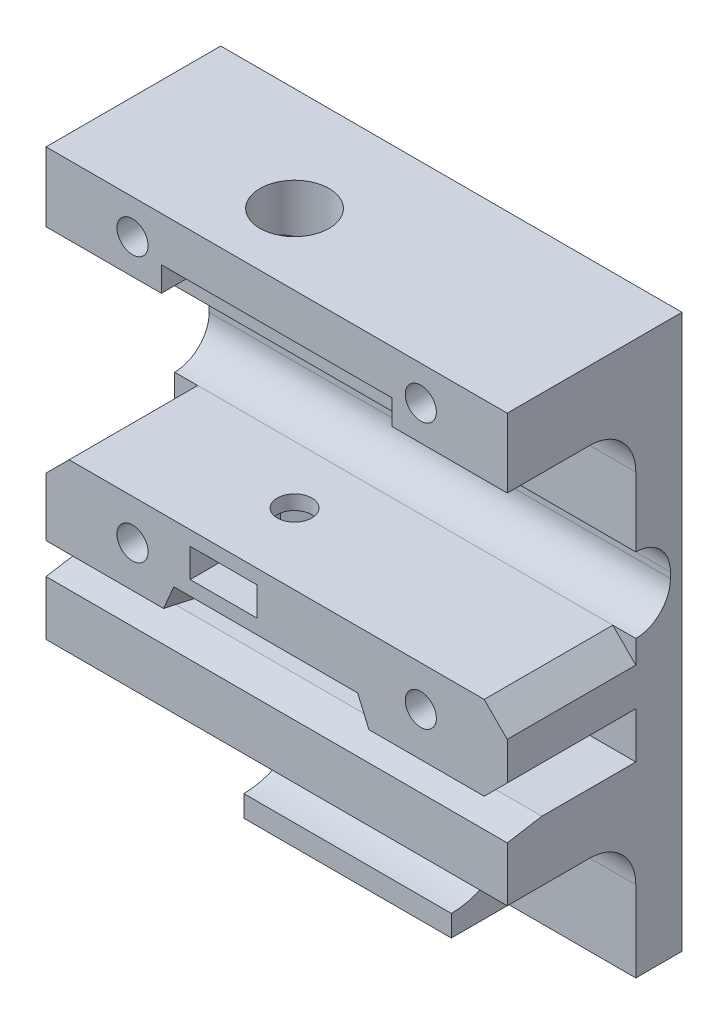
from build123d import *

# Parameters (mm, degrees)
SKETCH1_W                = 40
SKETCH1_H                = 48
BOSS_EXTRUDE1_DEPTH      = 4
BOSS_EXTRUDE2_DEPTH      = 11.15
BOSS_EXTRUDE2_DEPTH_BACK = 4
SKETCH5_W                = 40
SKETCH5_H                = 5.225
SKETCH5_W_2              = 18
SKETCH5_H_2              = 5
SKETCH5_H_3              = 6
FILLET1_R                = 4
SKETCH6_R                = 1.35
CUT_EXTRUDE4_DEPTH       = 58.214705278
CHAMFER2_SIZE            = 2
SKETCH7_W                = 40
SKETCH7_H                = 6.5
CUT_EXTRUDE5_DEPTH       = 3
FILLET2_R                = 3
CHAMFER3_SIZE            = 3
CHAMFER3_SIZE2           = 1
CHAMFER4_SIZE            = 3
CHAMFER4_SIZE2           = 0.5
CUT_EXTRUDE6_DEPTH       = 10
CUT_EXTRUDE6_DEPTH_BACK  = 10
CUT_EXTRUDE8_REACH       = 66.292
SKETCH12_R               = 3
SKETCH13_R               = 1.5
CUT_EXTRUDE10_DEPTH      = 10.275
CUT_EXTRUDE7_DEPTH       = 1.25
CUT_EXTRUDE7_DEPTH_BACK  = 1.25


with BuildPart() as part:
    # Sketch1 → Boss-Extrude1 (new body)
    with BuildSketch(Plane.XY):
        with Locations((20, 14)):
            Rectangle(SKETCH1_W, SKETCH1_H)
    extrude(amount=BOSS_EXTRUDE1_DEPTH)

    # Sketch5 → Boss-Extrude2 (add, two sides: drawn at the far end of the back side and taken through both)
    with BuildSketch(Plane.XY.offset(4).offset(-BOSS_EXTRUDE2_DEPTH_BACK)):
        Polygon((0.9, 8.125), (0, 8.125), (0, 15.5), (40, 15.5), (40, 8.225), (28, 8.225), (27.025, 10.5), (11.081237185, 10.5), (9.763380042, 7.425), (8.800403155, 7.425), (8.500403155, 8.125), (7.531690021, 8.125), (7.231690021, 7.425), (6.221941609, 7.425), (5.921941609, 8.125), (5, 8.125), (4.7, 7.425), (3.7, 7.425), (3.4, 8.125), (2.5, 8.125), (2.2, 7.425), (1.2, 7.425), align=None)
        with Locations((20, 3.6125)):
            Rectangle(SKETCH5_W, SKETCH5_H)
        with Locations((20, -7.5)):
            Rectangle(SKETCH5_W_2, SKETCH5_H_2)
        with Locations((20, 35)):
            Rectangle(SKETCH5_W, SKETCH5_H_3)
    extrude(amount=BOSS_EXTRUDE2_DEPTH + BOSS_EXTRUDE2_DEPTH_BACK)

    # Fillet1
    fillet1_edges = [part.edges().sort_by_distance(p)[0] for p in [
        (20, 1, 4),
        (20, 32, 4),
    ]]
    fillet(fillet1_edges, radius=FILLET1_R)

    # Sketch6 → Cut-Extrude4 (cut, through all)
    with BuildSketch(Plane.XY.offset(15.15)):
        with Locations((7.5, 35)):
            Circle(SKETCH6_R)
        with Locations((7.5, 12)):
            Circle(SKETCH6_R)
        with Locations((32.5, 35)):
            Circle(SKETCH6_R)
        with Locations((32.5, 12)):
            Circle(SKETCH6_R)
    extrude(amount=-CUT_EXTRUDE4_DEPTH, mode=Mode.SUBTRACT)

    # Chamfer2
    chamfer2_edges = [part.edges().sort_by_distance(p)[0] for p in [
        (40, 8.225, 9.575),
        (0, 15.5, 9.575),
        (40, 15.5, 9.575),
    ]]
    chamfer(chamfer2_edges, length=CHAMFER2_SIZE)

    # Sketch7 → Cut-Extrude5 (cut)
    with BuildSketch(Plane.XY.offset(4)):
        with Locations((20, 18.75)):
            Rectangle(SKETCH7_W, SKETCH7_H)
    extrude(amount=-CUT_EXTRUDE5_DEPTH, mode=Mode.SUBTRACT)

    # Fillet2
    fillet2_edges = [part.edges().sort_by_distance(p)[0] for p in [
        (20, 15.5, 1),
        (20, 22, 1),
    ]]
    fillet(fillet2_edges, radius=FILLET2_R - 0.0001)  # a hair under: the kernel refuses the full size

    # Chamfer3
    chamfer3_edges = [part.edges().sort_by_distance(p)[0] for p in [
        (4.2, 7.425, 15.15),
    ]]
    chamfer3_side = [part.faces().sort_by_distance(p)[0] for p in [
        (4.2, 7.425, 9.575),
    ]]
    chamfer(chamfer3_edges, length=CHAMFER3_SIZE, length2=CHAMFER3_SIZE2, reference=chamfer3_side[0])

    # Chamfer4
    chamfer4_edges = [part.edges().sort_by_distance(p)[0] for p in [
        (20, 6.225, 15.15),
    ]]
    chamfer4_side = [part.faces().sort_by_distance(p)[0] for p in [
        (20, 6.225, 9.575),
    ]]
    chamfer(chamfer4_edges, length=CHAMFER4_SIZE, length2=CHAMFER4_SIZE2, reference=chamfer4_side[0])

    # Sketch8 → Cut-Extrude6 (cut, two sides: drawn at the far end of the back side and taken through both)
    with BuildSketch(Plane(origin=(20, 0, 0), x_dir=(0, 0, -1), z_dir=(1, 0, 0)).offset(-CUT_EXTRUDE6_DEPTH_BACK)):
        with BuildLine():
            Line((-9, 34.15), (-18.856272107, 34.15))
            Line((-18.856272107, 34.15), (-18.856272107, 21.85))
            Line((-18.856272107, 21.85), (-9, 21.85))
            ThreePointArc((-9, 21.85), (-2.85, 28), (-9, 34.15))
        make_face()
        with BuildLine():
            Line((-18.856272107, -10.437196649), (-18.856272107, -3.158858698))
            Line((-18.856272107, -3.158858698), (-13.348706704, 2.348706704))
            ThreePointArc((-13.348706704, 2.348706704), (-3.318140875, 0.353503109), (-9, -8.15))
            Line((-9, -8.15), (-9, -10.437196649))
            Line((-9, -10.437196649), (-18.856272107, -10.437196649))
        make_face()
    extrude(amount=CUT_EXTRUDE6_DEPTH + CUT_EXTRUDE6_DEPTH_BACK, mode=Mode.SUBTRACT)

    # Cut-Extrude8: up to this face of the body (flat: up to its plane)
    cut_extrude8_end = Plane(part.part.faces().sort_by_distance((20, 15.5, 9.574944444))[0])
    # Sketch12 → Cut-Extrude8 (cut, up to the picked face)
    with BuildSketch(Plane(origin=(0, 38, 0), x_dir=(1, 0, 0), z_dir=(0, 1, 0)), mode=Mode.PRIVATE) as cut_extrude8_sk1:
        with Locations(Location((15.4, -9, 0), (0, 0, 270))):
            Circle(SKETCH12_R)
    cut_extrude8_tool1 = split(extrude(cut_extrude8_sk1.sketch, amount=-CUT_EXTRUDE8_REACH, mode=Mode.PRIVATE), bisect_by=cut_extrude8_end, keep=Keep.BOTH, mode=Mode.PRIVATE)
    add(cut_extrude8_tool1.solids().sort_by(Axis((15.4, 38, 9), (0, -1, 0)))[0], mode=Mode.SUBTRACT)

    # Sketch13 → Cut-Extrude10 (cut)
    with BuildSketch(Plane(origin=(0, 15.5, 0), x_dir=(1, 0, 0), z_dir=(0, 1, 0))):
        with Locations(Location((15.4, -9, 0), (0, 0, 180))):
            Circle(SKETCH13_R)
    extrude(amount=-CUT_EXTRUDE10_DEPTH, mode=Mode.SUBTRACT)

    # Sketch9 → Cut-Extrude7 (cut, two sides: drawn at the far end of the back side and taken through both)
    with BuildSketch(Plane.XZ.offset(-13).offset(-CUT_EXTRUDE7_DEPTH_BACK)):
        Polygon((12.5, 16.815347994), (18.3, 16.815347994), (18.3, 7.325684219), (15.4, 5.651368439), (12.5, 7.325684219), align=None)
    extrude(amount=CUT_EXTRUDE7_DEPTH + CUT_EXTRUDE7_DEPTH_BACK, mode=Mode.SUBTRACT)


solid = part.part
